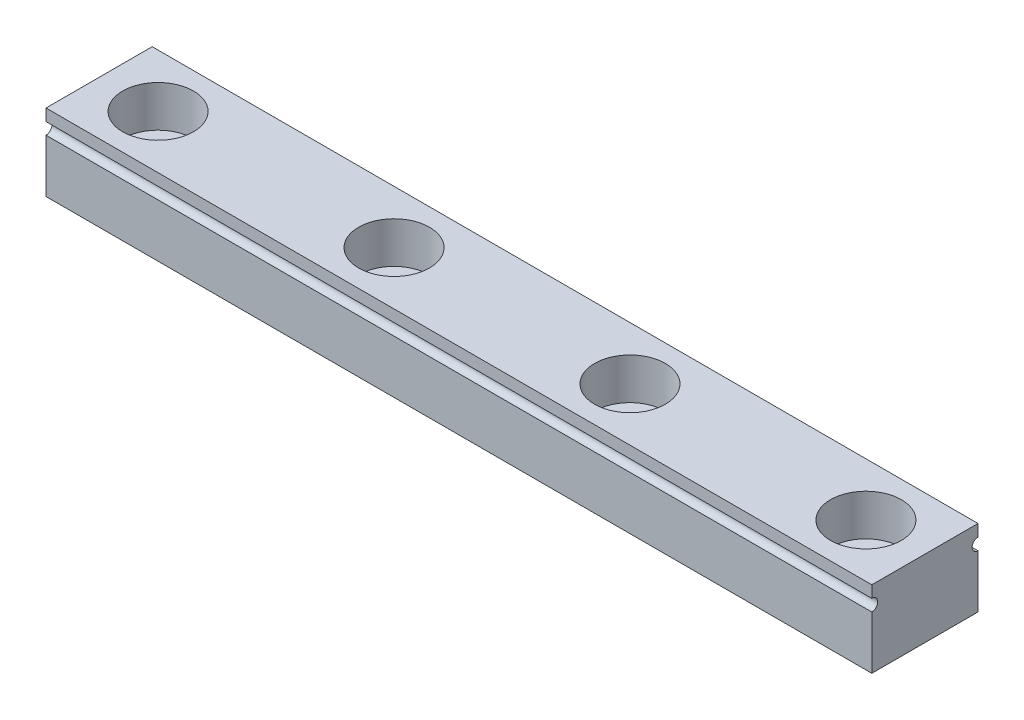
from build123d import *

# Parameters (mm, degrees)
IT_IS_6_5MM_DONT_FUCKIN_CHANGE_DEPTH = 70
SKETCH2_R                            = 1.5
CUT_EXTRUDE1_DEPTH                   = 71.445014018
SKETCH3_R                            = 3
CUT_EXTRUDE2_DEPTH                   = 3.5


with BuildPart() as part:
    # Sketch1 → it is 6.5mm, dont fuckin change (new body)
    with BuildSketch(Plane(origin=(0, 0, 0), x_dir=(0, 0, -1), z_dir=(1, 0, 0))):
        with BuildLine():
            Line((4.5, 3.25), (-4.5, 3.25))
            Line((-4.5, 3.25), (-4.5, 2.25))
            ThreePointArc((-4.5, 2.25), (-4.146446609, 2.103553391), (-4, 1.75))
            ThreePointArc((-4, 1.75), (-4.146446609, 1.396446609), (-4.5, 1.25))
            Line((-4.5, 1.25), (-4.5, -3.25))
            Line((-4.5, -3.25), (4.5, -3.25))
            Line((4.5, -3.25), (4.5, 1.25))
            ThreePointArc((4.5, 1.25), (4, 1.75), (4.5, 2.25))
            Line((4.5, 2.25), (4.5, 3.25))
        make_face()
    extrude(amount=IT_IS_6_5MM_DONT_FUCKIN_CHANGE_DEPTH)

    # Sketch2 → Cut-Extrude1 (cut, through all)
    with BuildSketch(Plane(origin=(0, 3.25, 0), x_dir=(1, 0, 0), z_dir=(0, 1, 0))):
        with Locations((5, 0)):
            Circle(SKETCH2_R)
        with Locations((25, 0)):
            Circle(SKETCH2_R)
        with Locations((45, 0)):
            Circle(SKETCH2_R)
        with Locations((65, 0)):
            Circle(SKETCH2_R)
    extrude(amount=-CUT_EXTRUDE1_DEPTH, mode=Mode.SUBTRACT)

    # Sketch3 → Cut-Extrude2 (cut)
    with BuildSketch(Plane(origin=(0, 3.25, 0), x_dir=(1, 0, 0), z_dir=(0, 1, 0))):
        with Locations((5, 0)):
            Circle(SKETCH3_R)
        with Locations((25, 0)):
            Circle(SKETCH3_R)
        with Locations((45, 0)):
            Circle(SKETCH3_R)
        with Locations((65, 0)):
            Circle(SKETCH3_R)
    extrude(amount=-CUT_EXTRUDE2_DEPTH, mode=Mode.SUBTRACT)


solid = part.part
